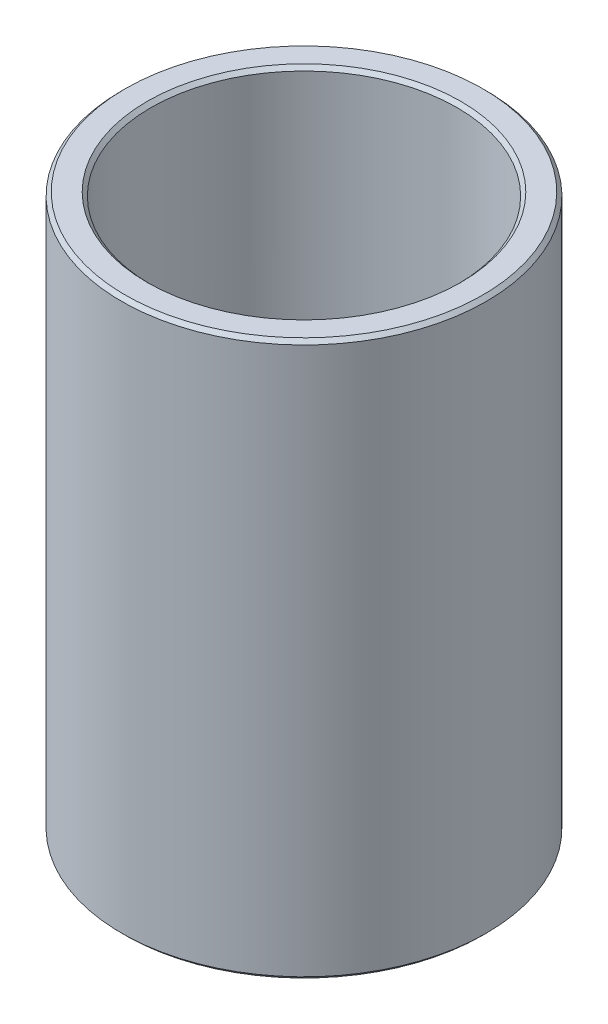
from build123d import *

# Parameters (mm, degrees)
CHAMFER1_SIZE = 0.25


with BuildPart() as part:
    # Sketch1 → Revolve1 (revolve)
    with BuildSketch(Plane.XY):
        Polygon((2, 0), (2, 1), (5, 4), (10.5, 4), (10.5, 38), (12.5, 38), (12.5, 0), align=None)
    revolve(axis=Axis((0, -587.15114798, 0), (0, 1, 0)))

    # Chamfer1
    chamfer1_edges = [part.edges().sort_by_distance(p)[0] for p in [
        (-12.5, 38, 0),
        (-10.5, 38, 0),
        (-12.5, 0, 0),
        (-2, 0, 0),
    ]]
    chamfer(chamfer1_edges, length=CHAMFER1_SIZE)


solid = part.part
